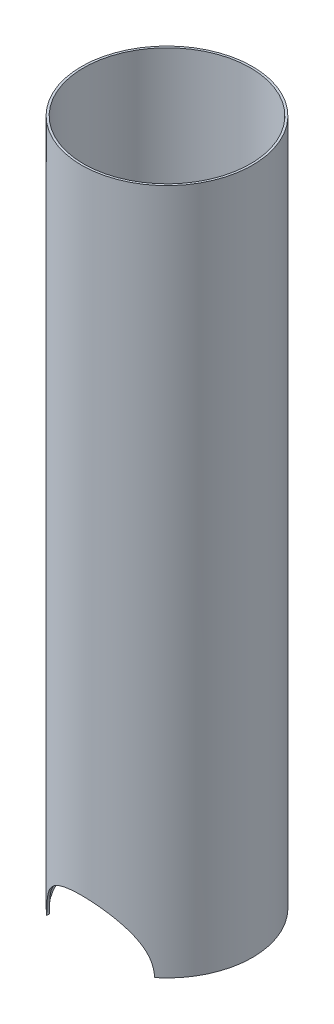
from build123d import *

# Parameters (mm, degrees)
OEM_DEPTH                        = 457.2
OEM_DEPTH_BACK                   = 152.4
SKETCH1_R                        = 63.5
SKETCH1_R_2                      = 61.9125
ENSR_BASEPLATE_CUTOUT_DEPTH      = 466.935982727
ENSR_BASEPLATE_CUTOUT_DEPTH_BACK = 466.935982727
TOO_LONG_DEPTH                   = 466.935982853
TOO_LONG_DEPTH_BACK              = 466.935982853
SKETCH6_W                        = 127
SKETCH6_H                        = 100
CONDUIT_DEPTH                    = 300
CONDUIT_DEPTH_BACK               = 10
SKETCH7_R                        = 4.7625
SKETCH7_R_2                      = 3.175
SKETCH3_R                        = 63.5
SKETCH3_R_2                      = 3.175
FLOOR_2_DEPTH                    = 1.5875


with BuildPart() as part:
    # Sketch1 → OEM (new, two sides: drawn at the far end of the back side and taken through both)
    with BuildSketch(Plane(origin=(0, 0, 0), x_dir=(1, 0, 0), z_dir=(0, 1, 0)).offset(-OEM_DEPTH_BACK)):
        Circle(SKETCH1_R)
        Circle(SKETCH1_R_2, mode=Mode.SUBTRACT)
    extrude(amount=OEM_DEPTH + OEM_DEPTH_BACK)

    # Sketch5 → eNSR baseplate cutout (cut, two sides: drawn at the far end of the back side and taken through both)
    with BuildSketch(Plane.XY.offset(-ENSR_BASEPLATE_CUTOUT_DEPTH_BACK)):
        with BuildLine():
            Line((40, -1399.047742892), (40, -152.4))
            ThreePointArc((40, -152.4), (0, -112.4), (-40, -152.4))
            Line((-40, -152.4), (-40, -1399.047742892))
            Line((-40, -1399.047742892), (-40, -3892.343228676))
            Line((-40, -3892.343228676), (40, -3892.343228676))
            Line((40, -3892.343228676), (40, -1399.047742892))
        make_face()
    extrude(amount=ENSR_BASEPLATE_CUTOUT_DEPTH + ENSR_BASEPLATE_CUTOUT_DEPTH_BACK, mode=Mode.SUBTRACT)

    # Sketch6 → too long (cut, two sides: drawn at the far end of the back side and taken through both)
    with BuildSketch(Plane.XY.offset(-TOO_LONG_DEPTH_BACK)):
        with Locations((0, 407.2)):
            Rectangle(SKETCH6_W, SKETCH6_H)
    extrude(amount=TOO_LONG_DEPTH + TOO_LONG_DEPTH_BACK, mode=Mode.SUBTRACT)

    # Sketch7 → conduit (add, two sides: drawn at the far end of the back side and taken through both)
    with BuildSketch(Plane(origin=(0, -110, 0), x_dir=(1, 0, 0), z_dir=(0, 1, 0)).offset(-CONDUIT_DEPTH_BACK)):
        with Locations((58.7375, 0)):
            Circle(SKETCH7_R)
        with Locations((58.7375, 0)):
            Circle(SKETCH7_R_2, mode=Mode.SUBTRACT)
    extrude(amount=CONDUIT_DEPTH + CONDUIT_DEPTH_BACK)

    # Sketch3 → floor 2 (add)
    with BuildSketch(Plane(origin=(0, -110, 0), x_dir=(1, 0, 0), z_dir=(0, 1, 0))):
        Circle(SKETCH3_R)
        with Locations((58.7375, 0)):
            Circle(SKETCH3_R_2, mode=Mode.SUBTRACT)
    extrude(amount=FLOOR_2_DEPTH)


solid = part.part
